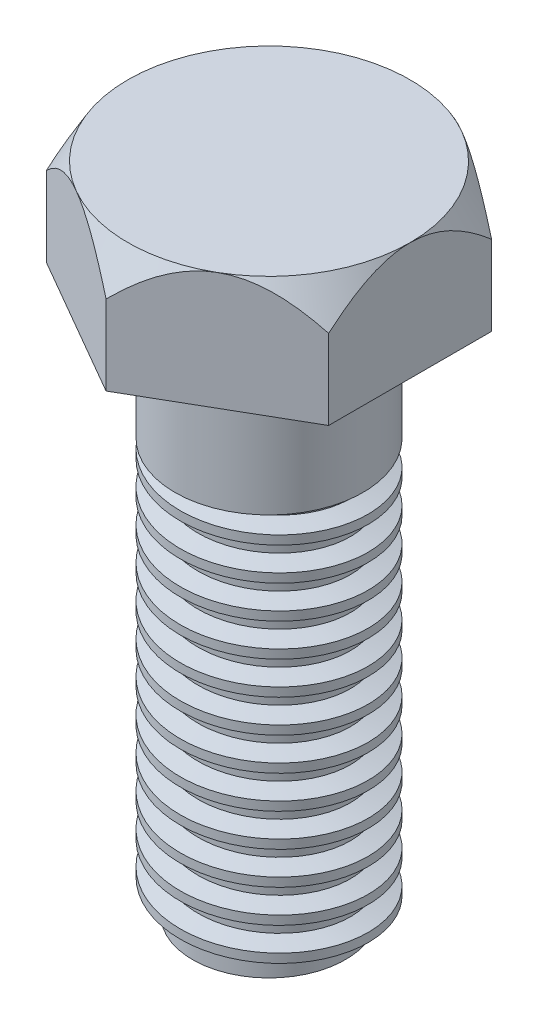
from build123d import *
from build123d.topology import SkipClean

# Parameters (mm, degrees)
BOSS_EXTRUDE1_START = 110
SKETCH2_R           = 20
BOSS_EXTRUDE1_DEPTH = 26
SKETCH3_R           = 16.25
BOSS_EXTRUDE2_DEPTH = 84
BOSS_EXTRUDE3_DEPTH = 25
SKETCH5_OUTSIDE_W   = 260.408
SKETCH5_OUTSIDE_H   = 269.69
SKETCH5_OUTSIDE_R   = 29.999119987
CUT_EXTRUDE1_DEPTH  = 143.565342212
CUT_EXTRUDE1_DRAFT  = -30
FILLET1_R           = 1
SWEEP1_PITCH        = 7
BOSS_EXTRUDE4_START = 84
SKETCH3_3_R         = 16.25
BOSS_EXTRUDE4_DEPTH = 3.899057


with BuildPart() as part:
    # Sketch2 → Boss-Extrude1 (new body)
    with BuildSketch(Plane(origin=(0, 0, 0), x_dir=(1, 0, 0), z_dir=(0, 1, 0)).offset(BOSS_EXTRUDE1_START)):
        with Locations(Location((0, 0, 0), (0, 0, 270))):
            Circle(SKETCH2_R)
    extrude(amount=-BOSS_EXTRUDE1_DEPTH)

    # Sketch3 → Boss-Extrude2 (add)
    with BuildSketch(Plane.XZ.offset(-84)):
        with Locations(Location((0, 0, 0), (0, 0, 90))):
            Circle(SKETCH3_R)
    extrude(amount=BOSS_EXTRUDE2_DEPTH)

    # Sketch4 → Boss-Extrude3 (add)
    with BuildSketch(Plane(origin=(0, 110, 0), x_dir=(1, 0, 0), z_dir=(0, 1, 0))):
        Polygon((-29.999119987, 17.32), (-29.999119987, -17.32), (0, -34.64), (29.999119987, -17.32), (29.999119987, 17.32), (0, 34.64), align=None)
    extrude(amount=BOSS_EXTRUDE3_DEPTH)


with BuildPart() as cut_extrude1_tool:
    # Sketch5 outside → Cut-Extrude1 (with draft: the straight prism first)
    with BuildSketch(Plane(origin=(0, 135, 0), x_dir=(1, 0, 0), z_dir=(0, 1, 0))):
        Rectangle(SKETCH5_OUTSIDE_W, SKETCH5_OUTSIDE_H)
        Circle(SKETCH5_OUTSIDE_R, mode=Mode.SUBTRACT)
    extrude(amount=-CUT_EXTRUDE1_DEPTH)
    # Cut-Extrude1: the draft: its side faces are tilted about the plane it starts from
    cut_extrude1_sides = [cut_extrude1_tool.faces().sort_by_distance(p)[0] for p in [
        (0, 63.217328894, 134.845),
        (130.204, 63.217328894, 0),
        (0, 63.217328894, -134.845),
        (-130.204, 63.217328894, 0),
        (-29.999119987, 63.217328894, 0),
    ]]
    draft(cut_extrude1_sides, Plane(origin=(0, 135, 0), x_dir=(1, 0, 0), z_dir=(0, 1, 0)), CUT_EXTRUDE1_DRAFT)


with BuildPart() as part_1:
    add(part.part)

    # Cut-Extrude1: cut by cut_extrude1_tool
    add(cut_extrude1_tool.part, mode=Mode.SUBTRACT)

    # Fillet1
    fillet1_edges = [part_1.edges().sort_by_distance(p)[0] for p in [
        (0, 110, -20),
    ]]
    fillet(fillet1_edges, radius=FILLET1_R)

    # Sweep1: arcs per turn and ends read off the stored shape
    # Sweep1: the profile of Sketch7 profile screwed along a left-hand helix through 12 turns, 14 arcs to a turn; built about Z, then put on its axis
    with SkipClean():  # the faces are left unmerged after this step: merging them gives an invalid solid
        sweep1_z = Axis((0, 0, 0), (0, 0, 1))
        sweep1_corners = [(16.25, 0, 0), (20.0003, 0, -1.004889856), (20.0003, 0, -2.894166808), (16.25, 0, -3.899056665)]
        with BuildLine(mode=Mode.PRIVATE) as sweep1_profile:
            Line(sweep1_corners[0], sweep1_corners[1])
            Line(sweep1_corners[1], sweep1_corners[2])
            Line(sweep1_corners[2], sweep1_corners[3])
            Line(sweep1_corners[3], sweep1_corners[0])
        sweep1_cap = Face(sweep1_profile.wire())
        sweep1_turn_angles = [0, -12.857142857, -25.714285714, -38.571428571, -51.428571429, -64.285714286, -77.142857143, -90, -102.857142857, -115.714285714, -128.571428571, -141.428571429, -154.285714286, -167.142857143, -180, -192.857142857, -205.714285714, -218.571428571, -231.428571429, -244.285714286, -257.142857143, -270, -282.857142857, -295.714285714, -308.571428571, -321.428571429, -334.285714286, -347.142857143, -360]
        sweep1_turn_weights = [1, 0.9749279121818236, 1, 0.9749279121818236, 1, 0.9749279121818236, 1, 0.9749279121818236, 1, 0.9749279121818236, 1, 0.9749279121818236, 1, 0.9749279121818236, 1, 0.9749279121818236, 1, 0.9749279121818236, 1, 0.9749279121818236, 1, 0.9749279121818236, 1, 0.9749279121818237, 1, 0.9749279121818236, 1, 0.9749279121818236, 1]
        sweep1_turn_rails = [Edge.make_bspline([Vector(p[0], p[1], 0).rotate(sweep1_z, sweep1_turn_angles[k]) / sweep1_turn_weights[k] + Vector(0, 0, p[2] + -SWEEP1_PITCH * sweep1_turn_angles[k] / 360) for k in range(29)], [0, 0, 0, 1, 1, 2, 2, 3, 3, 4, 4, 5, 5, 6, 6, 7, 7, 8, 8, 9, 9, 10, 10, 11, 11, 12, 12, 13, 13, 14, 14, 14], 2, sweep1_turn_weights) for p in sweep1_corners]
        sweep1_turn_sides = [Face.make_surface_from_curves(sweep1_turn_rails[p[0]], sweep1_turn_rails[p[1]]) for p in [(0, 1), (1, 2), (2, 3), (3, 0)]]
        sweep1 = Plane(origin=(0, 0, 0), x_dir=(-1, 0, 0), z_dir=(0, 1, 0)) * Solid(Shell([*[p.moved(Location((0, 0, SWEEP1_PITCH * i))) for i in range(12) for p in sweep1_turn_sides], sweep1_cap, sweep1_cap.rotate(sweep1_z, -4320).moved(Location((0, 0, -SWEEP1_PITCH * -4320 / 360)))]))
        add(sweep1)

    # Sketch3<3> → Boss-Extrude4 (add)
    with SkipClean():  # the faces are left unmerged after this step: merging them gives an invalid solid
        with BuildSketch(Plane.XZ.offset(-84).offset(BOSS_EXTRUDE4_START)):
            Circle(SKETCH3_3_R)
        extrude(amount=BOSS_EXTRUDE4_DEPTH)


solid = part_1.part
